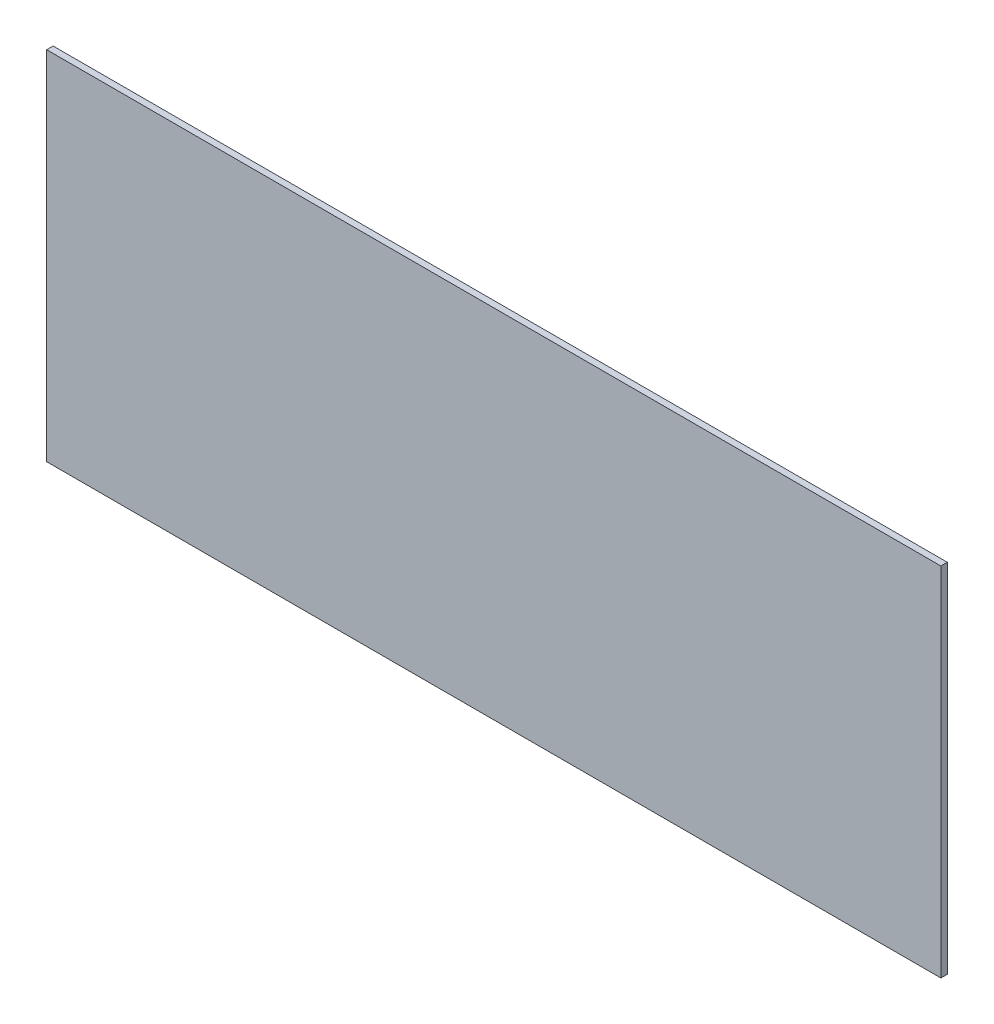
from build123d import *

# Parameters (mm, degrees)
SKETCH1_W           = 416
SKETCH1_H           = 166
BOSS_EXTRUDE1_DEPTH = 3


with BuildPart() as part:
    # Sketch1 → Boss-Extrude1 (new body)
    with BuildSketch(Plane.XY):
        with Locations((-50, 0)):
            Rectangle(SKETCH1_W, SKETCH1_H)
    extrude(amount=BOSS_EXTRUDE1_DEPTH)


solid = part.part
